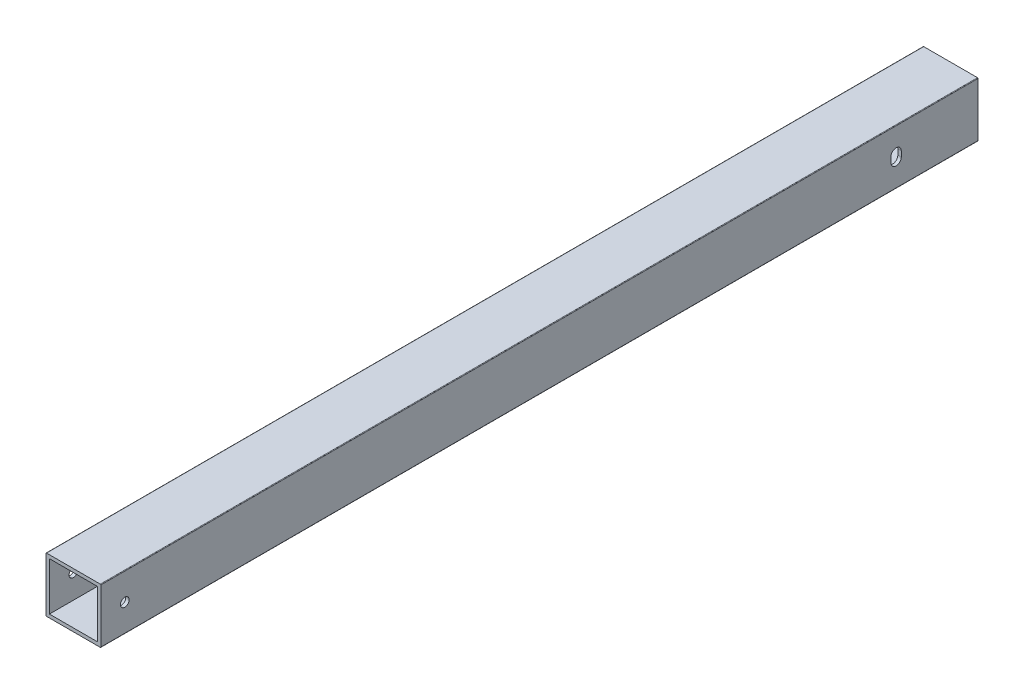
from build123d import *

# Parameters (mm, degrees)
SKETCH1_W           = 22.225
SKETCH1_H           = 22.225
BOSS_EXTRUDE1_DEPTH = 406.4
CUT_EXTRUDE2_DEPTH  = 408.888655341
SKETCH6_R           = 2.0193
CUT_EXTRUDE3_DEPTH  = 408.888655341


with BuildPart() as part:
    # Sketch1 → Boss-Extrude1 (new body)
    with BuildSketch(Plane(origin=(0, 0, 0), x_dir=(-1, 0, 0), z_dir=(0, 0, -1))):
        with BuildLine():
            Line((1.5875, -1.3335), (1.5875, 23.5585))
            ThreePointArc((1.5875, 23.5585), (1.513105122, 23.738105122), (1.3335, 23.8125))
            Line((1.3335, 23.8125), (-23.5585, 23.8125))
            ThreePointArc((-23.5585, 23.8125), (-23.738105122, 23.738105122), (-23.8125, 23.5585))
            Line((-23.8125, 23.5585), (-23.8125, -1.3335))
            ThreePointArc((-23.8125, -1.3335), (-23.738105122, -1.513105122), (-23.5585, -1.5875))
            Line((-23.5585, -1.5875), (1.3335, -1.5875))
            ThreePointArc((1.3335, -1.5875), (1.513105122, -1.513105122), (1.5875, -1.3335))
        make_face()
        with Locations((-11.1125, 11.1125)):
            Rectangle(SKETCH1_W, SKETCH1_H, mode=Mode.SUBTRACT)
    extrude(amount=-BOSS_EXTRUDE1_DEPTH)

    # Sketch4 → Cut-Extrude2 (cut, through all)
    with BuildSketch(Plane(origin=(23.8125, 0, 0), x_dir=(0, 0, -1), z_dir=(1, 0, 0))):
        with BuildLine():
            ThreePointArc((-40.314518304, 9.8425), (-37.933268304, 7.46125), (-35.552018304, 9.8425))
            Line((-35.552018304, 9.8425), (-35.552018304, 12.3825))
            ThreePointArc((-35.552018304, 12.3825), (-37.933268304, 14.76375), (-40.314518304, 12.3825))
            Line((-40.314518304, 12.3825), (-40.314518304, 9.8425))
        make_face()
    extrude(amount=-CUT_EXTRUDE2_DEPTH, mode=Mode.SUBTRACT)

    # Sketch6 → Cut-Extrude3 (cut, through all)
    with BuildSketch(Plane.ZY.offset(1.5875)):
        with Locations((395.2875, 11.1125)):
            Circle(SKETCH6_R)
    extrude(amount=-CUT_EXTRUDE3_DEPTH, mode=Mode.SUBTRACT)


solid = part.part
